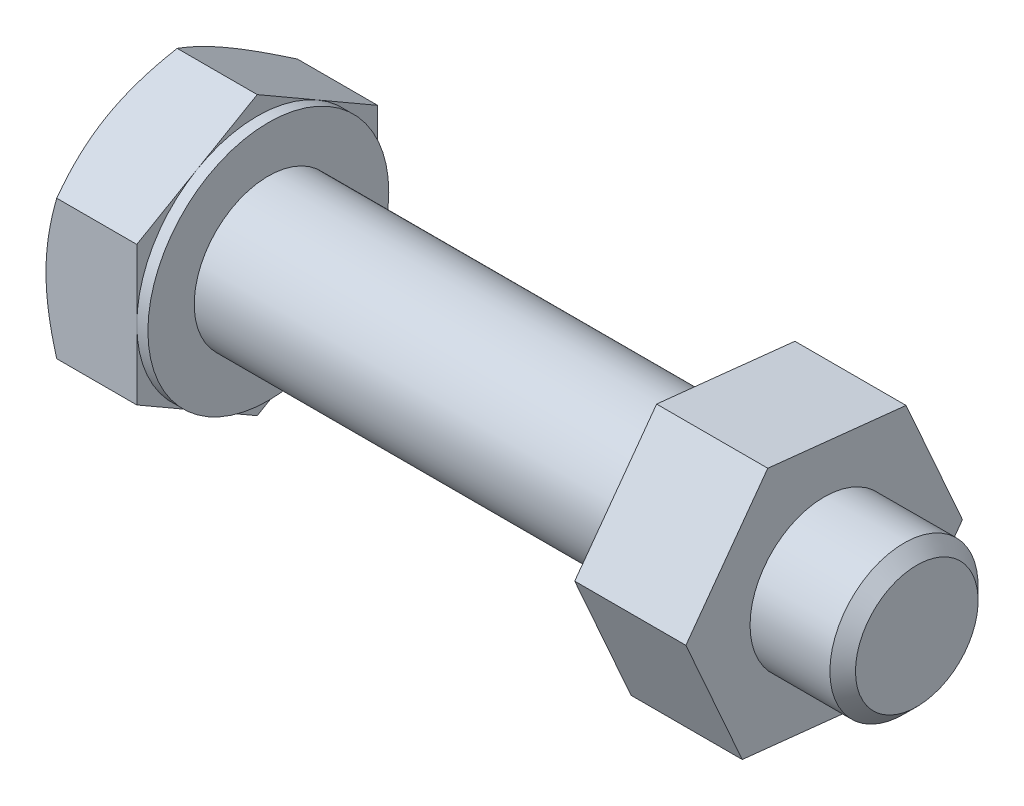
from build123d import *

# Parameters (mm, degrees)
BASEHEAD_DEPTH      = 5.5
SKETCH4_W           = 0.6
SKETCH4_H           = 11.005553499
BOSS_EXTRUDE1_DEPTH = 6


# Read off the part's stored shape, not the designer's step: HeadChamfer
with BuildPart() as part:
    # Sketch1 → BaseHead (new body)
    with BuildSketch(Plane(origin=(0, 0, 0), x_dir=(0, 0, -1), z_dir=(1, 0, 0))):
        Polygon((6.5, 3.75277675), (6.5, -3.75277675), (0, -7.505553499), (-6.5, -3.75277675), (-6.5, 3.75277675), (0, 7.505553499), align=None)
    extrude(amount=BASEHEAD_DEPTH)

    # HeadChamfer outline → HeadChamfer (revolve, cut)
    with BuildSketch(Plane.YX):
        Polygon((7.505553503, 0.580556586), (6.499999425, -3.32e-07), (7.505553503, -1.347e-06), align=None)
    revolve(axis=Axis((0, 0, 0), (1, 0, 0)), mode=Mode.SUBTRACT)

    # HeadChamfer 2 outline → HeadChamfer 2 (revolve)
    with BuildSketch(Plane.YX):
        Polygon((4, 5.5), (4, 39.8095), (3.3095, 40.5), (0, 40.5), (0, 5.5), align=None)
    revolve(axis=Axis((0, 0, 0), (1, 0, 0)))

    # Sketch4 → BearingFace (revolve, cut)
    with BuildSketch(Plane.XY, mode=Mode.PRIVATE) as bearingface_sk:
        with Locations((5.2, 12.00277675)):
            Rectangle(SKETCH4_W, SKETCH4_H)
    revolve(bearingface_sk.sketch.rotate(Axis((0, 0, 0), (1, 0, 0)), 90), axis=Axis((0, 0, 0), (1, 0, 0)), mode=Mode.SUBTRACT)

    # Sketch5 → Boss-Extrude1 (add)
    with BuildSketch(Plane(origin=(35.5, 0, 0), x_dir=(0, 0, -1), z_dir=(1, 0, 0))):
        Polygon((-3.043097903, 6.86096848), (-7.46332195, 0.79508415), (-4.420224047, -6.06588433), (3.043097903, -6.86096848), (7.46332195, -0.79508415), (4.420224047, 6.06588433), align=None)
    extrude(amount=-BOSS_EXTRUDE1_DEPTH)


solid = part.part
